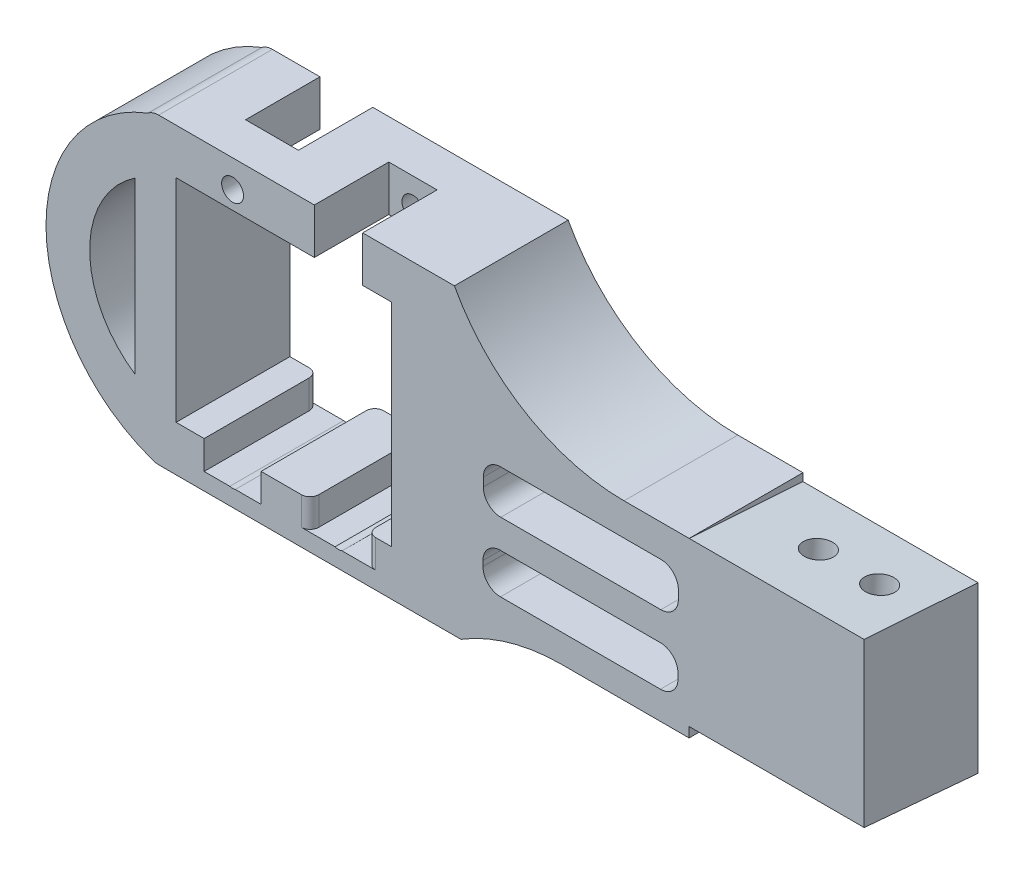
from build123d import *

# Parameters (mm, degrees)
SKETCH_1_W           = 32.6
SKETCH_1_H           = 34.6
SKETCH_1_R           = 1.25
SKETCH_1_W_2         = 24.6
SKETCH_1_H_2         = 24.2
EXTRUDE_1_DEPTH      = 13
SKETCH_3_W           = 6.5
SKETCH_3_H           = 6.519005167
CUT_EXTRUDE_1_DEPTH  = 19
SKETCH_4_W           = 6.5
SKETCH_4_H           = 6.467668889
CUT_EXTRUDE_2_DEPTH  = 23
EXTRUDE_2_DEPTH      = 50
SKETCH_1_2_W         = 22.27659965
SKETCH_1_2_H         = 4.598586669
SKETCH_1_2_W_2       = 22.283050596
SKETCH_1_2_H_2       = 4.977540741
CUT_EXTRUDE_5_DEPTH  = 34
FILLET_1_R           = 2
FILLET_2_R           = 2
FILLET_5_R           = 1
SKETCH_9_W           = 54.594998093
SKETCH_9_H           = 18.111982385
SKETCH_9_W_2         = 52.534809486
SKETCH_9_H_2         = 12.989301534
CUT_EXTRUDE_6_DEPTH  = 41
FILLET_6_R           = 22
EXTRUDE_4_DEPTH      = 13
SKETCH_13_W          = 5.518907879
SKETCH_13_H          = 8.361822047
CUT_EXTRUDE_8_DEPTH  = 8.5
SKETCH_14_W          = 6.038657432
SKETCH_14_H          = 7.741248121
CUT_EXTRUDE_9_DEPTH  = 8.5
SKETCH_15_OUTSIDE_W  = 35.102
SKETCH_15_OUTSIDE_H  = 56.702
CUT_EXTRUDE_11_DEPTH = 20
SKETCH_20_R          = 1.625
CUT_EXTRUDE_15_DEPTH = 40


with BuildPart() as part:
    # Sketch 1 → 凸台-拉伸1 (new body)
    with BuildSketch(Plane.XY):
        with Locations((-9.850980392, 1.274712581)):
            Rectangle(SKETCH_1_W, SKETCH_1_H)
        with Locations(Location((-15.700980392, 15.424712581, 0), (0, 0, 180))):
            Circle(SKETCH_1_R, mode=Mode.SUBTRACT)
        with Locations(Location((-3.600980392, 15.424712581, 0), (0, 0, 180))):
            Circle(SKETCH_1_R, mode=Mode.SUBTRACT)
        with Locations(Location((-15.700980392, -12.875287419, 0), (0, 0, 180))):
            Circle(SKETCH_1_R, mode=Mode.SUBTRACT)
        with Locations(Location((-3.600980392, -12.875287419, 0), (0, 0, 180))):
            Circle(SKETCH_1_R, mode=Mode.SUBTRACT)
        with Locations((-9.850980392, 1.274712581)):
            Rectangle(SKETCH_1_W_2, SKETCH_1_H_2, mode=Mode.SUBTRACT)
    extrude(amount=EXTRUDE_1_DEPTH)

    # 草图3 → 切除-拉伸1 (cut)
    with BuildSketch(Plane(origin=(0, 0, 0), x_dir=(-1, 0, 0), z_dir=(0, 0, -1))):
        with Locations((15.700980392, -10.82528742)):
            Rectangle(SKETCH_3_W, SKETCH_3_H)
    extrude(amount=-CUT_EXTRUDE_1_DEPTH, mode=Mode.SUBTRACT)

    # 草图4 → 切除-拉伸2 (cut)
    with BuildSketch(Plane.XY.offset(13)):
        with Locations((-3.600980392, -10.82528742)):
            Rectangle(SKETCH_4_W, SKETCH_4_H)
    extrude(amount=-CUT_EXTRUDE_2_DEPTH, mode=Mode.SUBTRACT)

    # 草图5 → 凸台-拉伸2 (add)
    with BuildSketch(Plane(origin=(6.449019608, 0, 0), x_dir=(0, 0, -1), z_dir=(1, 0, 0))):
        Polygon((-13, 18.574712581), (-13, 10.055461473), (-13, -16.025287419), (0, -16.025287419), (0, -15.027567927), (0, 16.282461831), (0, 18.574712581), align=None)
    extrude(amount=EXTRUDE_2_DEPTH)

    # Sketch 1 2 → 切除-拉伸5 (cut)
    with BuildSketch(Plane.XY.offset(13)):
        with Locations((24.037173058, -7.263594431)):
            Rectangle(SKETCH_1_2_W, SKETCH_1_2_H)
        with Locations((24.078382453, 0.81654228)):
            Rectangle(SKETCH_1_2_W_2, SKETCH_1_2_H_2)
    extrude(amount=-CUT_EXTRUDE_5_DEPTH, mode=Mode.SUBTRACT)

    # 圆角1
    fillet_1_edges = [part.edges().sort_by_distance(p)[0] for p in [
        (12.936857155, -1.672228091, 6.5),
        (12.936857155, 3.30531265, 6.5),
        (35.219907751, 3.30531265, 6.5),
        (35.219907751, -1.672228091, 6.5),
        (12.898873233, -9.562887765, 6.5),
        (12.898873233, -4.964301096, 6.5),
        (35.175472883, -4.964301096, 6.5),
        (35.175472883, -9.562887765, 6.5),
    ]]
    fillet(fillet_1_edges, radius=FILLET_1_R)

    # 圆角2
    fillet_2_edges = [part.edges().sort_by_distance(p)[0] for p in [
        (-26.150980392, -16.025287419, 6.5),
        (-26.150980392, 18.574712581, 6.5),
    ]]
    fillet(fillet_2_edges, radius=FILLET_2_R)

    # 圆角5
    fillet_5_edges = [part.edges().sort_by_distance(p)[0] for p in [
        (-12.450980392, -12.455038711, 0),
        (-18.950980392, -12.455038711, 0),
        (-6.850980392, -12.442204642, 13),
        (-0.350980392, -12.442204642, 13),
    ]]
    fillet(fillet_5_edges, radius=FILLET_5_R)

    # 草图9 → 切除-拉伸6 (cut)
    with BuildSketch(Plane(origin=(0, 0, 0), x_dir=(-1, 0, 0), z_dir=(0, 0, -1))):
        with Locations((-36.934177516, 16.051357777)):
            Rectangle(SKETCH_9_W, SKETCH_9_H)
        with Locations((-36.653242706, -19.247200889)):
            Rectangle(SKETCH_9_W_2, SKETCH_9_H_2)
    extrude(amount=-CUT_EXTRUDE_6_DEPTH, mode=Mode.SUBTRACT)

    # 圆角6
    # the kernel refuses this fillet: 22 mm, written as the material it adds along each edge
    with BuildSketch(Plane(origin=(9.636678469, 6.995366584, 0), x_dir=(0, 1, 0), z_dir=(0, 0, 1))) as fillet_6_piece_1:
        with BuildLine():
            CenterArc((22, -19.375499223), FILLET_6_R, 118.272534833, 61.727465167)
            Line((0, -19.375499223), (-0.44, -19.375499223))
            Line((-0.44, -19.375499223), (-0.44, 0))
            Line((-0.44, 0), (0, 0.44))
            ThreePointArc((0, 0.44), (5.789672998, 0.44), (11.370932916, 0.387509984))
            Line((11.370932916, 0.387509984), (11.579345996, 0))
        make_face()
    extrude(amount=13)
    with BuildSketch(Plane(origin=(10.385837963, -12.752550122, 0), x_dir=(1, 0, 0), z_dir=(0, 0, 1))) as fillet_6_piece_2:
        with BuildLine():
            CenterArc((11.54511289, -22), FILLET_6_R, 90, 31.653290012)
            Line((0, -3.272737297), (-0.230902258, -2.898192043))
            ThreePointArc((-0.230902258, -2.898192043), (-0.44, -1.636368649), (-0.44, 0))
            Line((-0.44, 0), (0, 0.44))
            Line((0, 0.44), (11.54511289, 0.44))
            Line((11.54511289, 0.44), (11.54511289, 0))
        make_face()
    extrude(amount=13)

    # 草图12 → 凸台-拉伸4 (add)
    with BuildSketch(Plane(origin=(0, 0, 0), x_dir=(-1, 0, 0), z_dir=(0, 0, -1))):
        with BuildLine():
            Line((24.150980392, 18.574712581), (24.496655084, -15.99518818))
            ThreePointArc((24.496655084, -15.99518818), (37.015647173, 1.416671567), (24.150980392, 18.574712581))
        make_face()
        with BuildLine():
            Line((26.822698684, 1.289948959), (26.822698684, -8.431688638))
            ThreePointArc((26.822698684, -8.431688638), (32.027920461, 1.289948959), (26.822698684, 11.011586556))
            Line((26.822698684, 11.011586556), (26.822698684, 1.289948959))
        make_face(mode=Mode.SUBTRACT)
    extrude(amount=-EXTRUDE_4_DEPTH)

    # 草图13 → 切除-拉伸8 (cut)
    with BuildSketch(Plane.XY.offset(13)):
        with Locations((-3.600980393, 15.424712581)):
            Rectangle(SKETCH_13_W, SKETCH_13_H)
    extrude(amount=-CUT_EXTRUDE_8_DEPTH, mode=Mode.SUBTRACT)

    # 草图14 → 切除-拉伸9 (cut)
    with BuildSketch(Plane(origin=(0, 0, 0), x_dir=(-1, 0, 0), z_dir=(0, 0, -1))):
        with Locations((15.700980392, 15.424712581)):
            Rectangle(SKETCH_14_W, SKETCH_14_H)
    extrude(amount=-CUT_EXTRUDE_9_DEPTH, mode=Mode.SUBTRACT)

    # 草图15 outside → 切除-拉伸11 (cut)
    with BuildSketch(Plane(origin=(56.449019608, 0, 0), x_dir=(0, 0, -1), z_dir=(1, 0, 0))):
        with Locations((-6.5, 1.275)):
            Rectangle(SKETCH_15_OUTSIDE_W, SKETCH_15_OUTSIDE_H)
        Polygon((-13, 6.995366584), (6.023241537, 5.707746072), (0, -12.752550122), (-13, -11.615197497), align=None, mode=Mode.SUBTRACT)
    extrude(amount=-CUT_EXTRUDE_11_DEPTH, mode=Mode.SUBTRACT)

    # 草图20 → 切除-拉伸15 (cut)
    with BuildSketch(Plane(origin=(0, 6.087549391, -0.412046152), x_dir=(1, 0, 0), z_dir=(0, 0.9977170964112915, -0.06753218142946318))):
        with Locations(Location((44.449019608, -6.662988966, 0), (0, 0, 270))):
            Circle(SKETCH_20_R)
        with Locations(Location((51.449019608, -6.662988966, 0), (0, 0, 270))):
            Circle(SKETCH_20_R)
    extrude(amount=-CUT_EXTRUDE_15_DEPTH, mode=Mode.SUBTRACT)


solid = part.part
